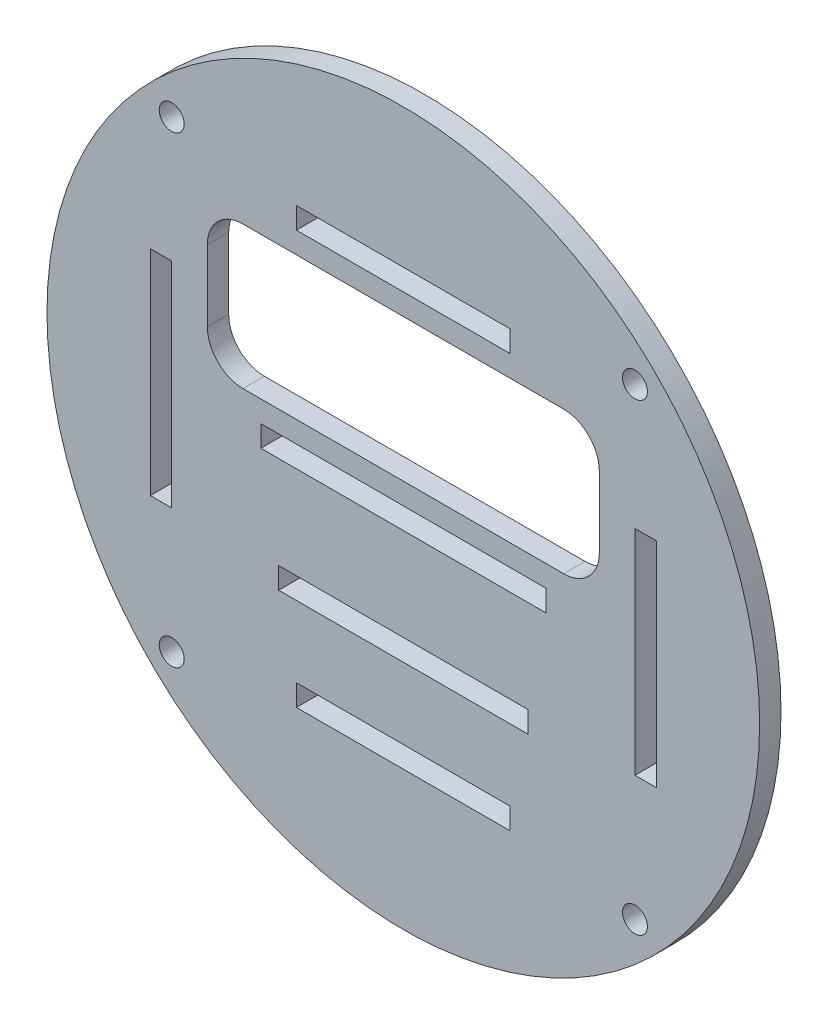
from build123d import *

# Parameters (mm, degrees)
SKETCH_1_R          = 50
EXTRUDE_1_DEPTH     = 3
SKETCH_2_W          = 30
SKETCH_2_H          = 3
SKETCH_2_W_2        = 35
SKETCH_2_W_3        = 40
CUT_EXTRUDE_1_DEPTH = 8
CUT_EXTRUDE_2_DEPTH = 10
SKETCH_4_W          = 2.995674625
SKETCH_4_H          = 30
CUT_EXTRUDE_3_DEPTH = 10
SKETCH_5_R          = 1.75
CUT_EXTRUDE_4_DEPTH = 10


with BuildPart() as part:
    # Эскиз1 → Бобышка-Вытянуть1 (new body)
    with BuildSketch(Plane.XY):
        Circle(SKETCH_1_R)
    extrude(amount=EXTRUDE_1_DEPTH)

    # Эскиз2 → Вырез-Вытянуть1 (cut)
    with BuildSketch(Plane.XY.offset(3)):
        with Locations((0, -29)):
            Rectangle(SKETCH_2_W, SKETCH_2_H)
        with Locations((0, -16)):
            Rectangle(SKETCH_2_W_2, SKETCH_2_H)
        Rectangle(SKETCH_2_W_3, SKETCH_2_H)
        with Locations((0, 29)):
            Rectangle(SKETCH_2_W, SKETCH_2_H)
    extrude(amount=-CUT_EXTRUDE_1_DEPTH, mode=Mode.SUBTRACT)

    # Эскиз3 → Вырез-Вытянуть2 (cut)
    with BuildSketch(Plane(origin=(0, 0, 0), x_dir=(-1, 0, 0), z_dir=(0, 0, -1))):
        with BuildLine():
            Line((-22.5, 24.5), (22.5, 24.5))
            ThreePointArc((22.5, 24.5), (26.035533906, 23.035533906), (27.5, 19.5))
            Line((27.5, 19.5), (27.5, 9.5))
            ThreePointArc((27.5, 9.5), (26.035533906, 5.964466094), (22.5, 4.5))
            Line((22.5, 4.5), (-22.5, 4.5))
            ThreePointArc((-22.5, 4.5), (-26.035533906, 5.964466094), (-27.5, 9.5))
            Line((-27.5, 9.5), (-27.5, 19.5))
            ThreePointArc((-27.5, 19.5), (-26.035533906, 23.035533906), (-22.5, 24.5))
        make_face()
    extrude(amount=-CUT_EXTRUDE_2_DEPTH, mode=Mode.SUBTRACT)

    # Эскиз4 → Вырез-Вытянуть3 (cut)
    with BuildSketch(Plane(origin=(0, 0, 0), x_dir=(-1, 0, 0), z_dir=(0, 0, -1))):
        with Locations((-33.997837312, 0)):
            Rectangle(SKETCH_4_W, SKETCH_4_H)
        with Locations((33.997837312, 0)):
            Rectangle(SKETCH_4_W, SKETCH_4_H)
    extrude(amount=-CUT_EXTRUDE_3_DEPTH, mode=Mode.SUBTRACT)

    # Эскиз5 → Вырез-Вытянуть4 (cut)
    with BuildSketch(Plane.XY.offset(3)):
        with Locations((-32.5, 32.5)):
            Circle(SKETCH_5_R)
        with Locations((32.5, 32.5)):
            Circle(SKETCH_5_R)
        with Locations((32.5, -32.5)):
            Circle(SKETCH_5_R)
        with Locations((-32.5, -32.5)):
            Circle(SKETCH_5_R)
    extrude(amount=-CUT_EXTRUDE_4_DEPTH, mode=Mode.SUBTRACT)


solid = part.part
